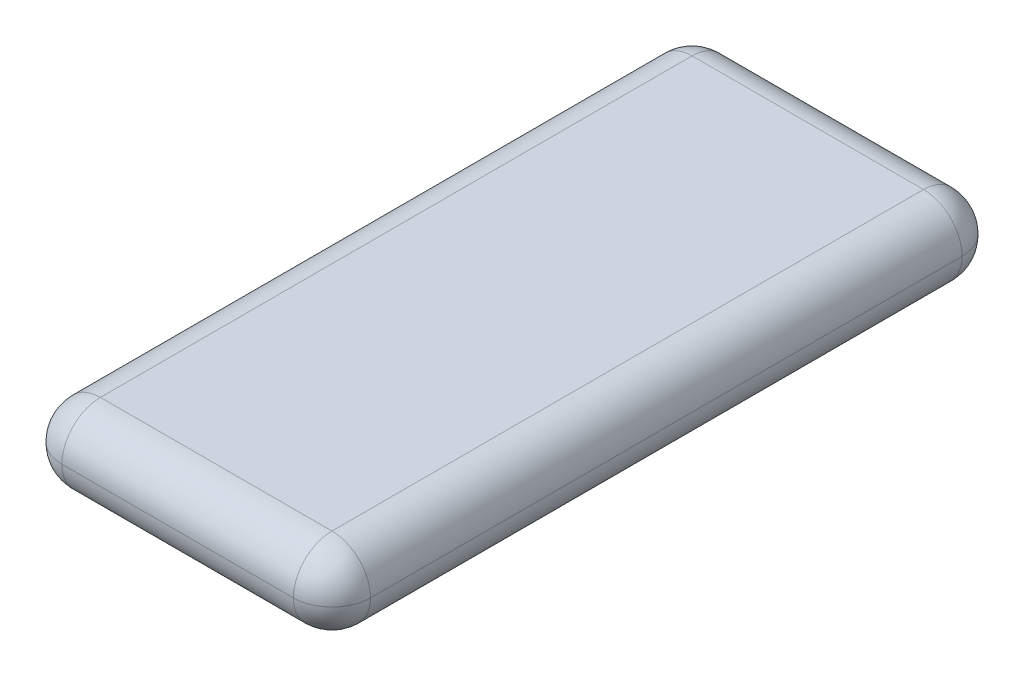
from build123d import *

# Parameters (mm, degrees)
SKETCH1_W           = 12
SKETCH1_H           = 26
BOSS_EXTRUDE1_DEPTH = 3
FILLET1_R           = 1.5


with BuildPart() as part:
    # Sketch1 → Boss-Extrude1 (new body)
    with BuildSketch(Plane(origin=(0, 0, 0), x_dir=(1, 0, 0), z_dir=(0, 1, 0))):
        Rectangle(SKETCH1_W, SKETCH1_H)
    extrude(amount=BOSS_EXTRUDE1_DEPTH)

    # Fillet1
    fillet1_edges = [part.edges().sort_by_distance(p)[0] for p in [
        (-6, 3, 0),
        (0, 3, 13),
        (6, 3, 0),
        (0, 0, 13),
        (-6, 0, 0),
        (0, 0, -13),
        (6, 0, 0),
        (6, 1.5, 13),
        (-6, 1.5, 13),
        (-6, 1.5, -13),
        (6, 1.5, -13),
        (0, 3, -13),
    ]]
    fillet(fillet1_edges, radius=FILLET1_R - 0.0001)  # a hair under: the kernel refuses the full size


solid = part.part
